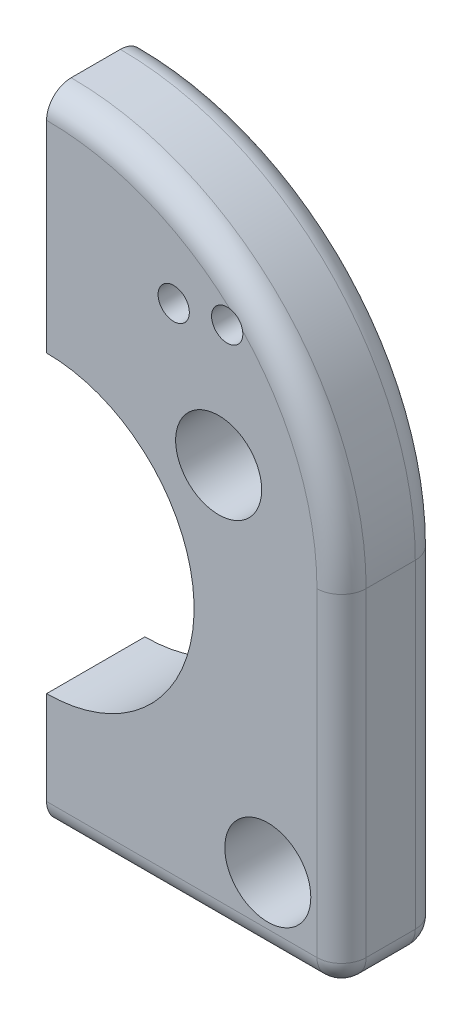
from build123d import *

# Parameters (mm, degrees)
SKETCH1_R                  = 5.55625
BOSS_EXTRUDE1_DEPTH        = 12.7
F_10_32_TAPPED_HOLE2_D     = 4.0386
F_10_32_TAPPED_HOLE3_D     = 4.0386
F_10_32_TAPPED_HOLE3_DEPTH = 16.002
F_10_32_TAPPED_HOLE3_TIP   = 1.213317848
FILLET1_R                  = 3.175


with BuildPart() as part:
    # Sketch1 → Boss-Extrude1 (new body)
    with BuildSketch(Plane.XY):
        with BuildLine():
            Line((-19.05, 0), (19.05, 0))
            Line((19.05, 0), (19.05, 44.45))
            ThreePointArc((19.05, 44.45), (7.890768363, 71.390768363), (-19.05, 82.55))
            Line((-19.05, 82.55), (-19.05, 53.34))
            ThreePointArc((-19.05, 53.34), (0, 34.29), (-19.05, 15.24))
            Line((-19.05, 15.24), (-19.05, 0))
        make_face()
        with Locations((9.525, 9.525)):
            Circle(SKETCH1_R, mode=Mode.SUBTRACT)
        with Locations((3.175, 51.914520005)):
            Circle(SKETCH1_R, mode=Mode.SUBTRACT)
    extrude(amount=BOSS_EXTRUDE1_DEPTH)

    # #10-32 Tapped Hole2 (through all)
    with Locations(Plane.XY.offset(12.7)):
        with Locations((-2.630812741, 67.096934822), (4.277109037, 68.131749636)):
            Hole(F_10_32_TAPPED_HOLE2_D / 2)

    # #10-32 Tapped Hole3
    with Locations(Plane.ZY.offset(19.05)):
        with Locations((6.35, 7.62), (6.35, 60.96)):
            Hole(F_10_32_TAPPED_HOLE3_D / 2, depth=F_10_32_TAPPED_HOLE3_DEPTH)
            with Locations((0, 0, -(F_10_32_TAPPED_HOLE3_DEPTH + F_10_32_TAPPED_HOLE3_TIP / 2))):  # 118° drill point
                Cone(0, F_10_32_TAPPED_HOLE3_D / 2, F_10_32_TAPPED_HOLE3_TIP, mode=Mode.SUBTRACT)

    # Fillet1
    # the kernel refuses this fillet: 3.175 mm, written as the material it takes off along each edge
    with BuildSketch(Plane(origin=(15.875, 3.175, 9.525), x_dir=(0, -1, 0), z_dir=(0, 0, 1))) as fillet1_piece_1_section:
        Polygon((0, 0), (FILLET1_R * 1.02, 0), (FILLET1_R * 1.02, FILLET1_R * 1.02), (0, FILLET1_R * 1.02), align=None)
    fillet1_piece_1 = extrude(amount=FILLET1_R * 1.02, mode=Mode.PRIVATE)
    fillet1_piece_1 = fillet1_piece_1 - Plane(origin=(15.875, 3.175, 9.525), x_dir=(-0.7071067811865476, 0.7071067811865475, 0), z_dir=(0, 0, 1)) * Sphere(FILLET1_R, mode=Mode.PRIVATE)
    add(fillet1_piece_1, mode=Mode.SUBTRACT)
    with BuildSketch(Plane(origin=(15.875, 3.175, 3.175), x_dir=(0, -1, 0), z_dir=(0, 0, -1))) as fillet1_piece_2_section:
        Polygon((0, 0), (FILLET1_R * 1.02, 0), (FILLET1_R * 1.02, -FILLET1_R * 1.02), (0, -FILLET1_R * 1.02), align=None)
    fillet1_piece_2 = extrude(amount=FILLET1_R * 1.02, mode=Mode.PRIVATE)
    fillet1_piece_2 = fillet1_piece_2 - Plane(origin=(15.875, 3.175, 3.175), x_dir=(-0.7071067811865476, 0.7071067811865475, 0), z_dir=(0, 0, -1)) * Sphere(FILLET1_R, mode=Mode.PRIVATE)
    add(fillet1_piece_2, mode=Mode.SUBTRACT)
    with BuildSketch(Plane(origin=(19.05, 3.175, 12.7), x_dir=(-1, 0, 0), z_dir=(0, 1, 0))) as fillet1_piece_3:
        with BuildLine():
            CenterArc((FILLET1_R, -FILLET1_R), FILLET1_R, 90, 90)
            Line((0, -FILLET1_R), (-FILLET1_R * 0.02, -FILLET1_R))
            Line((-FILLET1_R * 0.02, -FILLET1_R), (-FILLET1_R * 0.02, FILLET1_R * 0.02))
            Line((-FILLET1_R * 0.02, FILLET1_R * 0.02), (FILLET1_R, FILLET1_R * 0.02))
            Line((FILLET1_R, FILLET1_R * 0.02), (FILLET1_R, 0))
        make_face()
    extrude(amount=41.275, mode=Mode.SUBTRACT)
    with BuildSketch(Plane(origin=(19.05, 0, 3.175), x_dir=(-1, 0, 0), z_dir=(0, 0, 1))) as fillet1_piece_4:
        with BuildLine():
            CenterArc((FILLET1_R, -FILLET1_R), FILLET1_R, 90, 90)
            Line((0, -FILLET1_R), (-FILLET1_R * 0.02, -FILLET1_R))
            Line((-FILLET1_R * 0.02, -FILLET1_R), (-FILLET1_R * 0.02, FILLET1_R * 0.02))
            Line((-FILLET1_R * 0.02, FILLET1_R * 0.02), (FILLET1_R, FILLET1_R * 0.02))
            Line((FILLET1_R, FILLET1_R * 0.02), (FILLET1_R, 0))
        make_face()
    extrude(amount=6.35, mode=Mode.SUBTRACT)
    with BuildSketch(Plane(origin=(-19.05, 44.45, 12.7), x_dir=(1, 0, 0), z_dir=(0, -1, 0))) as fillet1_piece_5:
        with BuildLine():
            CenterArc((38.1 - FILLET1_R, -FILLET1_R), FILLET1_R, 0, 90)
            Line((38.1, -FILLET1_R), (38.1 + FILLET1_R * 0.02, -FILLET1_R))
            Line((38.1 + FILLET1_R * 0.02, -FILLET1_R), (38.1 + FILLET1_R * 0.02, FILLET1_R * 0.02))
            Line((38.1 + FILLET1_R * 0.02, FILLET1_R * 0.02), (38.1 - FILLET1_R, FILLET1_R * 0.02))
            Line((38.1 - FILLET1_R, FILLET1_R * 0.02), (38.1 - FILLET1_R, 0))
        make_face()
    revolve(axis=Axis((-19.05, 44.45, 12.7), (0, 0, 1)), revolution_arc=90, mode=Mode.SUBTRACT)
    with BuildSketch(Plane(origin=(-19.05, 44.45, 0), x_dir=(1, 0, 0), z_dir=(0, -1, 0))) as fillet1_piece_6:
        with BuildLine():
            CenterArc((38.1 - FILLET1_R, FILLET1_R), FILLET1_R, 270, 90)
            Line((38.1, FILLET1_R), (38.1 + FILLET1_R * 0.02, FILLET1_R))
            Line((38.1 + FILLET1_R * 0.02, FILLET1_R), (38.1 + FILLET1_R * 0.02, -FILLET1_R * 0.02))
            Line((38.1 + FILLET1_R * 0.02, -FILLET1_R * 0.02), (38.1 - FILLET1_R, -FILLET1_R * 0.02))
            Line((38.1 - FILLET1_R, -FILLET1_R * 0.02), (38.1 - FILLET1_R, 0))
        make_face()
    revolve(axis=Axis((-19.05, 44.45, 0), (0, 0, 1)), revolution_arc=90, mode=Mode.SUBTRACT)
    with BuildSketch(Plane(origin=(-19.05, 0, 12.7), x_dir=(0, 1, 0), z_dir=(1, 0, 0))) as fillet1_piece_7:
        with BuildLine():
            CenterArc((FILLET1_R, -FILLET1_R), FILLET1_R, 90, 90)
            Line((0, -FILLET1_R), (-FILLET1_R * 0.02, -FILLET1_R))
            Line((-FILLET1_R * 0.02, -FILLET1_R), (-FILLET1_R * 0.02, FILLET1_R * 0.02))
            Line((-FILLET1_R * 0.02, FILLET1_R * 0.02), (FILLET1_R, FILLET1_R * 0.02))
            Line((FILLET1_R, FILLET1_R * 0.02), (FILLET1_R, 0))
        make_face()
    extrude(amount=34.925, mode=Mode.SUBTRACT)
    with BuildSketch(Plane(origin=(19.05, 3.175, 0), x_dir=(-1, 0, 0), z_dir=(0, 1, 0))) as fillet1_piece_8:
        with BuildLine():
            CenterArc((FILLET1_R, FILLET1_R), FILLET1_R, 180, 90)
            Line((0, FILLET1_R), (-FILLET1_R * 0.02, FILLET1_R))
            Line((-FILLET1_R * 0.02, FILLET1_R), (-FILLET1_R * 0.02, -FILLET1_R * 0.02))
            Line((-FILLET1_R * 0.02, -FILLET1_R * 0.02), (FILLET1_R, -FILLET1_R * 0.02))
            Line((FILLET1_R, -FILLET1_R * 0.02), (FILLET1_R, 0))
        make_face()
    extrude(amount=41.275, mode=Mode.SUBTRACT)
    with BuildSketch(Plane(origin=(-19.05, 0, 0), x_dir=(0, 1, 0), z_dir=(1, 0, 0))) as fillet1_piece_9:
        with BuildLine():
            CenterArc((FILLET1_R, FILLET1_R), FILLET1_R, 180, 90)
            Line((0, FILLET1_R), (-FILLET1_R * 0.02, FILLET1_R))
            Line((-FILLET1_R * 0.02, FILLET1_R), (-FILLET1_R * 0.02, -FILLET1_R * 0.02))
            Line((-FILLET1_R * 0.02, -FILLET1_R * 0.02), (FILLET1_R, -FILLET1_R * 0.02))
            Line((FILLET1_R, -FILLET1_R * 0.02), (FILLET1_R, 0))
        make_face()
    extrude(amount=34.925, mode=Mode.SUBTRACT)


solid = part.part
